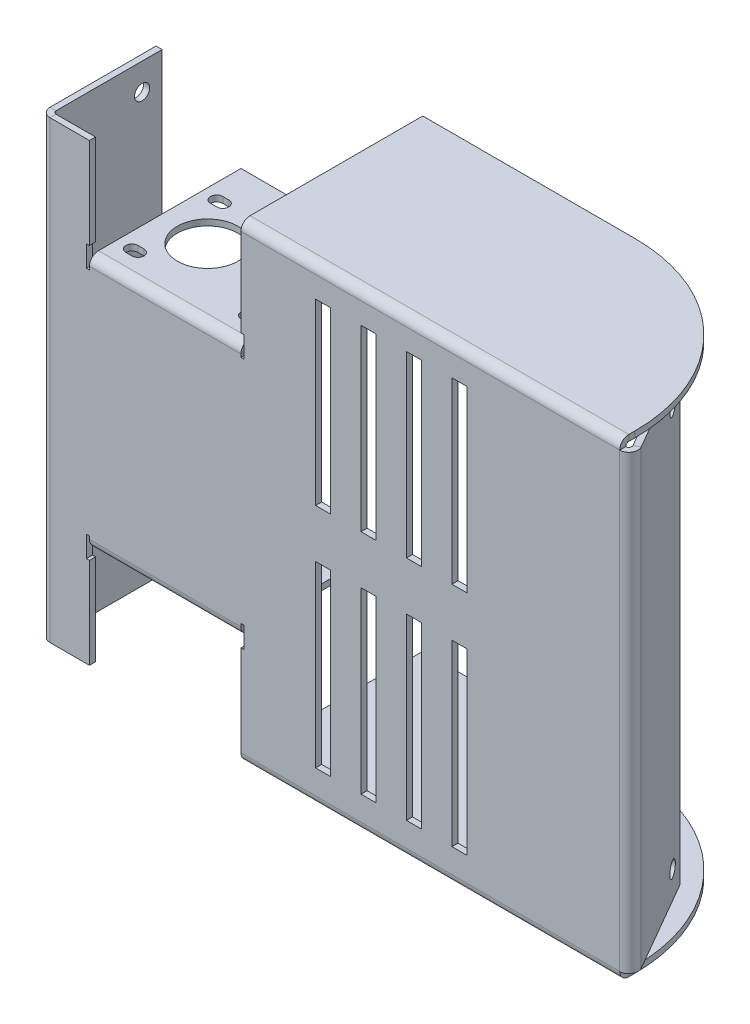
from build123d import *

# Parameters (mm, degrees)
SKETCH7_W                     = 220
SKETCH7_H                     = 150
BASE_FLANGE4_DEPTH            = 2
SKETCH38_W                    = 5
SKETCH38_H                    = 59
CUT_EXTRUDE9_DEPTH            = 10
EDGE_FLANGE9_STRIP_W          = 41
EDGE_FLANGE9_STRIP_H          = 2
EDGE_FLANGE9_STRIP_CUT_DEPTH  = 150
EDGE_FLANGE9_DEPTH            = 150
SKETCH22_W                    = 27.5
SKETCH22_H                    = 30
SKETCH22_W_2                  = 22.5
CUT_EXTRUDE14_DEPTH           = 2
EDGE_FLANGE13_START           = -66
EDGE_FLANGE13_DEPTH           = 52
EDGE_FLANGE13_2_DEPTH         = 1
EDGE_FLANGE13_START_2         = -15
EDGE_FLANGE13_3_DEPTH         = 1
EDGE_FLANGE13_START_3         = -65
EDGE_FLANGE13_4_DEPTH         = 50
EDGE_FLANGE14_START           = -66
EDGE_FLANGE14_DEPTH           = 52
EDGE_FLANGE14_2_DEPTH         = 1
EDGE_FLANGE14_START_2         = -15
EDGE_FLANGE14_3_DEPTH         = 1
EDGE_FLANGE14_START_3         = -65
EDGE_FLANGE14_4_DEPTH         = 50
SKETCH147_W                   = 13.585691309
SKETCH147_H                   = 30.654893209
CUT_EXTRUDE18_DEPTH           = 2
EDGE_FLANGE15_STRIP_W         = 10
EDGE_FLANGE15_STRIP_H         = 2
EDGE_FLANGE15_STRIP_CUT_DEPTH = 125
EDGE_FLANGE15_DEPTH           = 125
EDGE_FLANGE16_DEPTH           = 125
EDGE_FLANGE17_DEPTH           = 149
BREAK_CORNER4_START           = -78
BREAK_CORNER4_DEPTH           = 2
BREAK_CORNER4_START_2         = 75
BREAK_CORNER4_2_DEPTH         = 2
SKETCH164_R                   = 10
CUT_EXTRUDE20_DEPTH           = 176.410946067
SKETCH166_R                   = 2.5
CUT_EXTRUDE21_DEPTH           = 2
SKETCH167_R                   = 2.5
CUT_EXTRUDE24_DEPTH           = 5
SKETCH170_R                   = 2.5
CUT_EXTRUDE25_DEPTH           = 3


# Read off the part's stored shape, not the designer's step: Edge-Flange13, Edge-Flange14, Break-Corner4
# Sheet-metal steps are written as plain solids
with BuildPart() as part:
    # Sketch7 → Base-Flange4 (new body)
    with BuildSketch(Plane.XY):
        Rectangle(SKETCH7_W, SKETCH7_H)
    extrude(amount=-BASE_FLANGE4_DEPTH)

    # Sketch38 → Cut-Extrude9 (cut)
    with BuildSketch(Plane.XY):
        with Locations((12.126416544, -37.5)):
            Rectangle(SKETCH38_W, SKETCH38_H)
        with Locations((27.126416544, -37.5)):
            Rectangle(SKETCH38_W, SKETCH38_H)
        with Locations((42.126416544, -37.5)):
            Rectangle(SKETCH38_W, SKETCH38_H)
        with Locations((57.126416544, -37.5)):
            Rectangle(SKETCH38_W, SKETCH38_H)
        with Locations((57.126416544, 37.5)):
            Rectangle(SKETCH38_W, SKETCH38_H)
        with Locations((42.126416544, 37.5)):
            Rectangle(SKETCH38_W, SKETCH38_H)
        with Locations((27.126416544, 37.5)):
            Rectangle(SKETCH38_W, SKETCH38_H)
        with Locations((12.126416544, 37.5)):
            Rectangle(SKETCH38_W, SKETCH38_H)
    extrude(amount=-CUT_EXTRUDE9_DEPTH, mode=Mode.SUBTRACT)

    # Edge-Flange9 strip (across the edge) → Edge-Flange9 strip cut (cut)
    with BuildSketch(Plane(origin=(-79, -75, -2), x_dir=(1, 0, 0), z_dir=(0, 1, 0))):
        with Locations((-19.5, -1)):
            Rectangle(EDGE_FLANGE9_STRIP_W, EDGE_FLANGE9_STRIP_H)
    extrude(amount=EDGE_FLANGE9_STRIP_CUT_DEPTH, mode=Mode.SUBTRACT)

    # Edge-Flange9 section (across the edge) → Edge-Flange9 (add)
    with BuildSketch(Plane(origin=(-79, -75, -2), x_dir=(1, 0, 0), z_dir=(0, 1, 0))):
        with BuildLine():
            Line((-2, 1), (-2, 36))
            Line((-2, 36), (0, 36))
            Line((0, 36), (0, 1))
            ThreePointArc((0, 1), (0.292893219, 0.292893219), (1, 0))
            Line((1, 0), (1, -2))
            ThreePointArc((1, -2), (-1.121320344, -1.121320344), (-2, 1))
        make_face()
    extrude(amount=EDGE_FLANGE9_DEPTH)

    # Sketch22 → Cut-Extrude14 (cut)
    with BuildSketch(Plane(origin=(0, 0, -2), x_dir=(-1, 0, 0), z_dir=(0, 0, -1))):
        with Locations((51.25, 60)):
            Rectangle(SKETCH22_W, SKETCH22_H)
        with Locations((26.25, 60)):
            Rectangle(SKETCH22_W_2, SKETCH22_H)
        Polygon((65, -45), (37.5, -45), (15, -45), (15, -75), (65, -75), align=None)
    extrude(amount=-CUT_EXTRUDE14_DEPTH, mode=Mode.SUBTRACT)

    # Edge-Flange13 outline → Edge-Flange13 (cut)
    with BuildSketch(Plane.YZ.offset(EDGE_FLANGE13_START)):
        with BuildLine():
            Line((-45, 0), (-45, -2))
            Line((-45, -2), (-41.828427125, -2))
            ThreePointArc((-41.828427125, -2), (-40.732050808, -0.550510257), (-39, 0))
            Line((-39, 0), (-45, 0))
        make_face()
    extrude(amount=EDGE_FLANGE13_DEPTH, mode=Mode.SUBTRACT)

    # Edge-Flange13 2 outline → Edge-Flange13 2 (cut)
    with BuildSketch(Plane.YZ.offset(EDGE_FLANGE13_START)):
        with BuildLine():
            ThreePointArc((-39, 0), (-40.732050808, -0.550510257), (-41.828427125, -2))
            Line((-41.828427125, -2), (-38, -2))
            Line((-38, -2), (-38, 0))
            Line((-38, 0), (-39, 0))
        make_face()
    extrude(amount=EDGE_FLANGE13_2_DEPTH, mode=Mode.SUBTRACT)

    # Edge-Flange13 3 outline → Edge-Flange13 3 (cut)
    with BuildSketch(Plane.YZ.offset(EDGE_FLANGE13_START_2)):
        with BuildLine():
            ThreePointArc((-39, 0), (-40.732050808, -0.550510257), (-41.828427125, -2))
            Line((-41.828427125, -2), (-38, -2))
            Line((-38, -2), (-38, 0))
            Line((-38, 0), (-39, 0))
        make_face()
    extrude(amount=EDGE_FLANGE13_3_DEPTH, mode=Mode.SUBTRACT)

    # Edge-Flange13 4 outline → Edge-Flange13 4 (add)
    with BuildSketch(Plane.YZ.offset(EDGE_FLANGE13_START_3)):
        with BuildLine():
            Line((-39, -2), (-41.828427125, -2))
            ThreePointArc((-41.828427125, -2), (-41.956795679, -2.492694064), (-42, -3))
            Line((-42, -3), (-42, -50))
            Line((-42, -50), (-40, -50))
            Line((-40, -50), (-40, -3))
            ThreePointArc((-40, -3), (-39.707106781, -2.292893219), (-39, -2))
        make_face()
    extrude(amount=EDGE_FLANGE13_4_DEPTH)

    # Edge-Flange14 outline → Edge-Flange14 (cut)
    with BuildSketch(Plane.YZ.offset(EDGE_FLANGE14_START)):
        with BuildLine():
            ThreePointArc((39, 0), (40.732050808, -0.550510257), (41.828427125, -2))
            Line((41.828427125, -2), (45, -2))
            Line((45, -2), (45, 0))
            Line((45, 0), (39, 0))
        make_face()
    extrude(amount=EDGE_FLANGE14_DEPTH, mode=Mode.SUBTRACT)

    # Edge-Flange14 2 outline → Edge-Flange14 2 (cut)
    with BuildSketch(Plane.YZ.offset(EDGE_FLANGE14_START)):
        with BuildLine():
            Line((38, -2), (41.828427125, -2))
            ThreePointArc((41.828427125, -2), (40.732050808, -0.550510257), (39, 0))
            Line((39, 0), (38, 0))
            Line((38, 0), (38, -2))
        make_face()
    extrude(amount=EDGE_FLANGE14_2_DEPTH, mode=Mode.SUBTRACT)

    # Edge-Flange14 3 outline → Edge-Flange14 3 (cut)
    with BuildSketch(Plane.YZ.offset(EDGE_FLANGE14_START_2)):
        with BuildLine():
            Line((38, -2), (41.828427125, -2))
            ThreePointArc((41.828427125, -2), (40.732050808, -0.550510257), (39, 0))
            Line((39, 0), (38, 0))
            Line((38, 0), (38, -2))
        make_face()
    extrude(amount=EDGE_FLANGE14_3_DEPTH, mode=Mode.SUBTRACT)

    # Edge-Flange14 4 outline → Edge-Flange14 4 (add)
    with BuildSketch(Plane.YZ.offset(EDGE_FLANGE14_START_3)):
        with BuildLine():
            Line((40, -3), (40, -50))
            Line((40, -50), (42, -50))
            Line((42, -50), (42, -3))
            ThreePointArc((42, -3), (41.956795679, -2.492694064), (41.828427125, -2))
            Line((41.828427125, -2), (39, -2))
            ThreePointArc((39, -2), (39.707106781, -2.292893219), (40, -3))
        make_face()
    extrude(amount=EDGE_FLANGE14_4_DEPTH)

    # Sketch147 → Cut-Extrude18 (cut)
    with BuildSketch(Plane.ZY.offset(81)):
        with Locations((-16.117047991, 0.696702118)):
            Rectangle(SKETCH147_W, SKETCH147_H)
    extrude(amount=-CUT_EXTRUDE18_DEPTH, mode=Mode.SUBTRACT)

    # Edge-Flange15 strip (across the edge) → Edge-Flange15 strip cut (cut)
    with BuildSketch(Plane(origin=(-15, 75, -2), x_dir=(0, -1, 0), z_dir=(1, 0, 0))):
        with Locations((-4, -1)):
            Rectangle(EDGE_FLANGE15_STRIP_W, EDGE_FLANGE15_STRIP_H)
    extrude(amount=EDGE_FLANGE15_STRIP_CUT_DEPTH, mode=Mode.SUBTRACT)

    # Edge-Flange15 section (across the edge) → Edge-Flange15 (add)
    with BuildSketch(Plane(origin=(-15, 75, -2), x_dir=(0, -1, 0), z_dir=(1, 0, 0))):
        with BuildLine():
            Line((-2, 1), (-2, 58))
            Line((-2, 58), (0, 58))
            Line((0, 58), (0, 1))
            ThreePointArc((0, 1), (0.292893219, 0.292893219), (1, 0))
            Line((1, 0), (1, -2))
            ThreePointArc((1, -2), (-1.121320344, -1.121320344), (-2, 1))
        make_face()
    extrude(amount=EDGE_FLANGE15_DEPTH)

    # Edge-Flange16 section (across the edge) → Edge-Flange16 (add)
    with BuildSketch(Plane(origin=(110, -76, -2), x_dir=(0, 1, 0), z_dir=(-1, 0, 0))):
        with BuildLine():
            Line((-2, 1), (-2, 58))
            Line((-2, 58), (0, 58))
            Line((0, 58), (0, 1))
            ThreePointArc((0, 1), (0.292893219, 0.292893219), (1, 0))
            Line((1, 0), (1, -2))
            ThreePointArc((1, -2), (-1.121320344, -1.121320344), (-2, 1))
        make_face()
    extrude(amount=EDGE_FLANGE16_DEPTH)

    # Edge-Flange17 section (across the edge) → Edge-Flange17 (add)
    with BuildSketch(Plane(origin=(111.732050808, 74, -2), x_dir=(-0.8660254037844398, 0, 0.499999999999998), z_dir=(0, -1, 0))):
        with BuildLine():
            Line((-2, 1.732050808), (-2, 36.535898385))
            Line((-2, 36.535898385), (0, 36.535898385))
            Line((0, 36.535898385), (0, 1.732050808))
            ThreePointArc((0, 1.732050808), (0.5, 0.866025404), (1.5, 0.866025404))
            Line((1.5, 0.866025404), (2.5, -0.866025404))
            ThreePointArc((2.5, -0.866025404), (-0.5, -0.866025404), (-2, 1.732050808))
        make_face()
    extrude(amount=EDGE_FLANGE17_DEPTH)

    # Break-Corner4 outline → Break-Corner4 (cut)
    with BuildSketch(Plane(origin=(0, 0, 0), x_dir=(1, 0, 0), z_dir=(0, 1, 0)).offset(BREAK_CORNER4_START)):
        with BuildLine():
            ThreePointArc((55, 60), (93.890872965, 43.890872965), (110, 5))
            Line((110, 5), (110, 60))
            Line((110, 60), (55, 60))
        make_face()
    extrude(amount=BREAK_CORNER4_DEPTH, mode=Mode.SUBTRACT)

    # Break-Corner4 2 outline → Break-Corner4 2 (cut)
    with BuildSketch(Plane(origin=(0, 0, 0), x_dir=(1, 0, 0), z_dir=(0, 1, 0)).offset(BREAK_CORNER4_START_2)):
        with BuildLine():
            ThreePointArc((55, 60), (93.890872965, 43.890872965), (110, 5))
            Line((110, 5), (110, 60))
            Line((110, 60), (55, 60))
        make_face()
    extrude(amount=BREAK_CORNER4_2_DEPTH, mode=Mode.SUBTRACT)

    # Sketch164 → Cut-Extrude20 (cut, through all)
    with BuildSketch(Plane(origin=(0, 42, 0), x_dir=(1, 0, 0), z_dir=(0, 1, 0))):
        with Locations(Location((-49, 23, 0), (0, 0, 270))):
            Circle(SKETCH164_R)
        with BuildLine():
            Line((-20, 7), (-22, 7))
            ThreePointArc((-22, 7), (-24, 9), (-22, 11))
            Line((-22, 11), (-20, 11))
            ThreePointArc((-20, 11), (-18, 9), (-20, 7))
        make_face()
        with BuildLine():
            Line((-60, 11), (-58, 11))
            ThreePointArc((-58, 11), (-56, 9), (-58, 7))
            Line((-58, 7), (-60, 7))
            ThreePointArc((-60, 7), (-62, 9), (-60, 11))
        make_face()
        with BuildLine():
            Line((-60, 35), (-58, 35))
            ThreePointArc((-58, 35), (-56, 37), (-58, 39))
            Line((-58, 39), (-60, 39))
            ThreePointArc((-60, 39), (-62, 37), (-60, 35))
        make_face()
        with BuildLine():
            Line((-20, 39), (-22, 39))
            ThreePointArc((-22, 39), (-24, 37), (-22, 35))
            Line((-22, 35), (-20, 35))
            ThreePointArc((-20, 35), (-18, 37), (-20, 39))
        make_face()
    extrude(amount=-CUT_EXTRUDE20_DEPTH, mode=Mode.SUBTRACT)

    # Sketch166 → Cut-Extrude21 (cut)
    with BuildSketch(Plane(origin=(86.397114317, 0, -49.881397208), x_dir=(-0.4999999999999983, 0, -0.8660254037844397), z_dir=(0.8660254037844396, 0, -0.4999999999999982))):
        with Locations((-24.152476086, -66)):
            Circle(SKETCH166_R)
    extrude(amount=-CUT_EXTRUDE21_DEPTH, mode=Mode.SUBTRACT)

    # Sketch167 → Cut-Extrude24 (cut)
    with BuildSketch(Plane(origin=(86.397114317, 0, -49.881397208), x_dir=(-0.4999999999999983, 0, -0.8660254037844397), z_dir=(0.8660254037844396, 0, -0.4999999999999982))):
        with Locations((-24.152476086, 66)):
            Circle(SKETCH167_R)
    extrude(amount=-CUT_EXTRUDE24_DEPTH, mode=Mode.SUBTRACT)

    # Sketch170 → Cut-Extrude25 (cut)
    with BuildSketch(Plane.ZY.offset(81)):
        with Locations((-31.38, 66.11)):
            Circle(SKETCH170_R)
        with Locations((-31.38, -66.11)):
            Circle(SKETCH170_R)
    extrude(amount=-CUT_EXTRUDE25_DEPTH, mode=Mode.SUBTRACT)


solid = part.part
